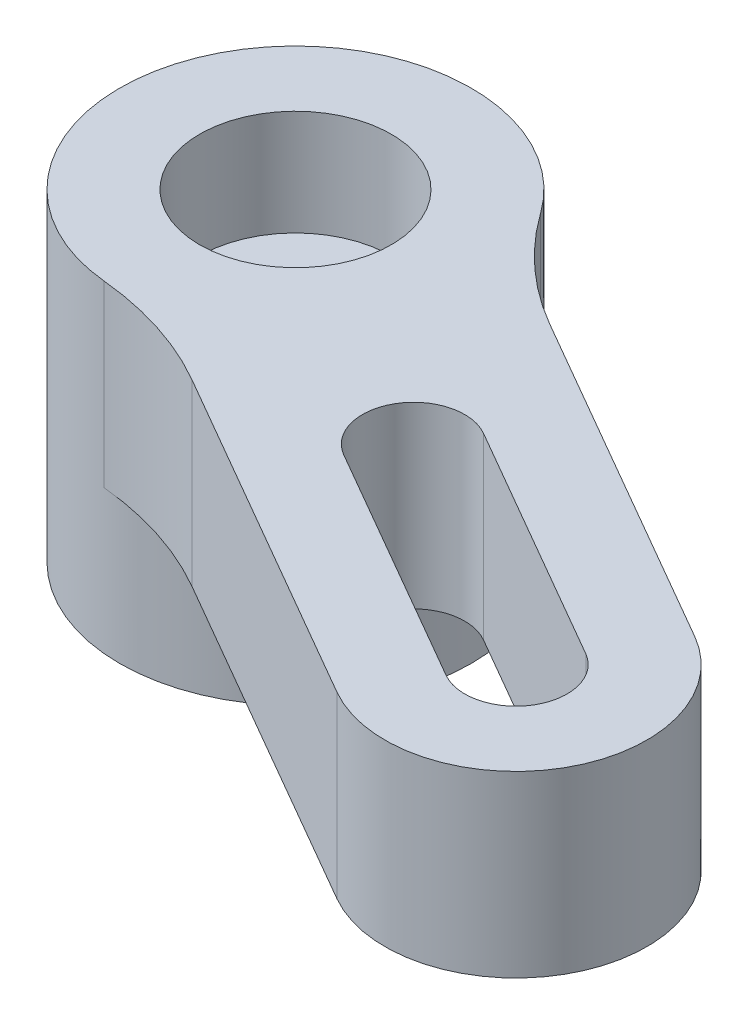
from build123d import *

# Parameters (mm, degrees)
EXTRUDE_THIN2_DEPTH      = 5.6
BOSS_EXTRUDE1_DEPTH      = 5.6
BOSS_EXTRUDE2_DEPTH      = 5.6
BOSS_EXTRUDE2_DEPTH_BACK = 4.5
SKETCH6_R                = 5.5
FILLET1_R                = 10
SKETCH7_R                = 2.77
CUT_EXTRUDE3_DEPTH       = 4
SKETCH9_R                = 3
CUT_EXTRUDE5_DEPTH       = 3.3
SKETCH10_R               = 1.6
CUT_EXTRUDE6_DEPTH       = 26.423002314


with BuildPart() as part:
    # Sketch4 → Extrude-Thin2 (new body)
    with BuildSketch(Plane(origin=(0, 0, 0), x_dir=(1, 0, 0), z_dir=(0, 1, 0))):
        with BuildLine():
            Line((10.796856578, -1.499295844), (18.374578861, -5.874295844))
            ThreePointArc((18.374578861, -5.874295844), (19.875283017, -11.475), (14.274578861, -12.975704156))
            Line((14.274578861, -12.975704156), (6.696856578, -8.600704156))
            ThreePointArc((6.696856578, -8.600704156), (5.196152423, -3), (10.796856578, -1.499295844))
        make_face()
        with BuildLine():
            Line((9.546856578, -3.664359354), (17.124578861, -8.039359354))
            ThreePointArc((17.124578861, -8.039359354), (17.710219507, -10.225), (15.524578861, -10.810640646))
            Line((15.524578861, -10.810640646), (7.946856578, -6.435640646))
            ThreePointArc((7.946856578, -6.435640646), (7.361215932, -4.25), (9.546856578, -3.664359354))
        make_face(mode=Mode.SUBTRACT)
    extrude(amount=EXTRUDE_THIN2_DEPTH)

    # Sketch5 → Boss-Extrude1 (add)
    with BuildSketch(Plane(origin=(0, 0, 0), x_dir=(1, 0, 0), z_dir=(0, 1, 0))):
        with BuildLine():
            Line((10.796856578, -1.499295844), (2.05, 3.550704156))
            ThreePointArc((2.05, 3.550704156), (-3.550704156, 2.05), (-2.05, -3.550704156))
            Line((-2.05, -3.550704156), (6.696856578, -8.600704156))
            ThreePointArc((6.696856578, -8.600704156), (8.998238507, -9.142286296), (11.216030786, -8.323099255))
            Line((11.216030786, -8.323099255), (7.946856578, -6.435640646))
            ThreePointArc((7.946856578, -6.435640646), (7.361215932, -4.25), (9.546856578, -3.664359354))
            Line((9.546856578, -3.664359354), (12.816030786, -5.551817963))
            ThreePointArc((12.816030786, -5.551817963), (12.416571434, -3.221559989), (10.796856578, -1.499295844))
        make_face()
    extrude(amount=BOSS_EXTRUDE1_DEPTH)

    # Sketch6 → Boss-Extrude2 (add, two sides: drawn at the far end of the back side and taken through both)
    with BuildSketch(Plane(origin=(0, 0, 0), x_dir=(1, 0, 0), z_dir=(0, 1, 0)).offset(-BOSS_EXTRUDE2_DEPTH_BACK)):
        with Locations(Location((0, 0, 0), (0, 0, 270))):
            Circle(SKETCH6_R)
    extrude(amount=BOSS_EXTRUDE2_DEPTH + BOSS_EXTRUDE2_DEPTH_BACK)

    # Fillet1
    # the kernel refuses this fillet: 10 mm, written as the material it adds along each edge
    with BuildSketch(Plane(origin=(1.124901573, 5.6, 5.383734433), x_dir=(0.8660254037844402, 0, 0.4999999999999975), z_dir=(0, -1, 0))) as fillet1_piece_1:
        with BuildLine():
            CenterArc((2.77133022, 10), FILLET1_R, 245.460811273, 24.539188727)
            ThreePointArc((-1.381825119, 0.903225806), (-0.65683145, 0.503752837), (0, 0))
            Line((0, 0), (2.77133022, 0))
        make_face()
    extrude(amount=5.6)
    with BuildSketch(Plane(origin=(5.224901573, 5.6, -1.717673878), x_dir=(0.8660254037844397, 0, 0.49999999999999806), z_dir=(0, -1, 0))) as fillet1_piece_2:
        with BuildLine():
            CenterArc((2.77133022, -10), FILLET1_R, 90, 24.539188727)
            ThreePointArc((-1.381825119, -0.903225806), (-0.65683145, -0.503752837), (0, 0))
            Line((0, 0), (2.77133022, 0))
        make_face()
    extrude(amount=5.6)

    # Sketch7 → Cut-Extrude3 (cut)
    with BuildSketch(Plane.XZ.offset(4.5)):
        with Locations(Location((0, 0, 0), (0, 0, 270))):
            Circle(SKETCH7_R)
    extrude(amount=-CUT_EXTRUDE3_DEPTH, mode=Mode.SUBTRACT)

    # Sketch9 → Cut-Extrude5 (cut)
    with BuildSketch(Plane(origin=(0, 5.6, 0), x_dir=(1, 0, 0), z_dir=(0, 1, 0))):
        with Locations(Location((0, 0, 0), (0, 0, 270))):
            Circle(SKETCH9_R)
    extrude(amount=-CUT_EXTRUDE5_DEPTH, mode=Mode.SUBTRACT)

    # Sketch10 → Cut-Extrude6 (cut, through all)
    with BuildSketch(Plane(origin=(0, 2.3, 0), x_dir=(1, 0, 0), z_dir=(0, 1, 0))):
        with Locations(Location((0, 0, 0), (0, 0, 270))):
            Circle(SKETCH10_R)
    extrude(amount=-CUT_EXTRUDE6_DEPTH, mode=Mode.SUBTRACT)


solid = part.part
